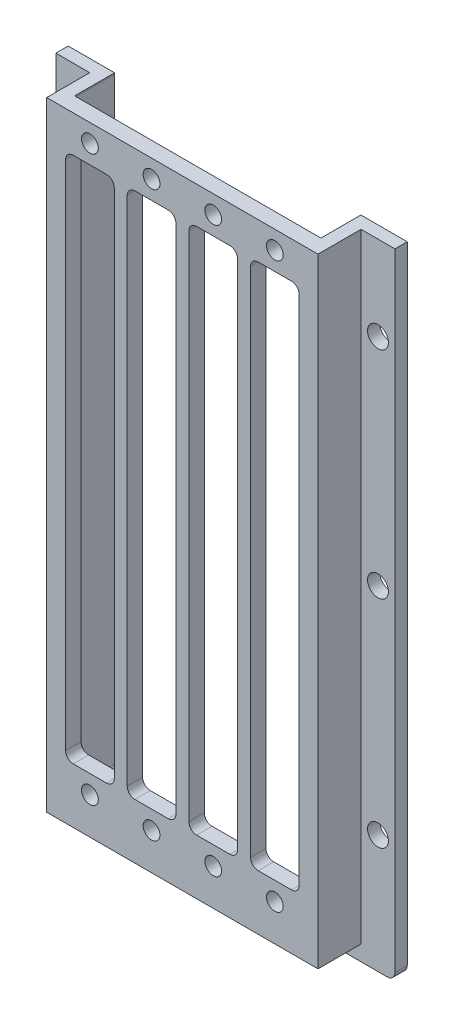
from build123d import *

# Parameters (mm, degrees)
SKETCH1_W                 = 50.8
SKETCH1_H                 = 126.238
BACK_DEPTH                = 3.175
CUT_EXTRUDE3_DEPTH        = 69.11203114
F_4_CLEARANCE_HOLE1_D     = 3.4544
LPATTERN1_OUTLINE_R       = 1.7272
LPATTERN1_DEPTH           = 3.175
SKETCH9_W                 = 55.88
SKETCH9_H                 = 131.318
WALLS_DEPTH               = 11.405821857
SKETCH11_W                = 69.85
SKETCH11_H                = 137.668
SKETCH11_W_2              = 50.8
SKETCH11_H_2              = 126.238
LIP_DEPTH                 = 2.54
F_6_CLEARANCE_OVERSIZED_D = 4.3053
FILLET2_R                 = 1.5875
CUT_EXTRUDE4_DEPTH        = 6.858
CUT_EXTRUDE4_DEPTH_BACK   = 3.81
SKETCH19_W                = 76.814856898
SKETCH19_H                = 21.095936882


# Read off the part's stored shape, not the designer's step: LPattern1
with BuildPart() as part:
    # Sketch1 → back (new body)
    with BuildSketch(Plane.XY):
        Rectangle(SKETCH1_W, SKETCH1_H)
    extrude(amount=BACK_DEPTH)

    # Sketch6 → Cut-Extrude3 (cut, through all)
    with BuildSketch(Plane.XY.offset(3.175)):
        with BuildLine():
            Line((24.07, -52.705), (24.07, 52.705))
            ThreePointArc((24.07, 52.705), (23.605032015, 53.827532015), (22.4825, 54.2925))
            Line((22.4825, 54.2925), (15.6245, 54.2925))
            ThreePointArc((15.6245, 54.2925), (14.501967985, 53.827532015), (14.037, 52.705))
            Line((14.037, 52.705), (14.037, -52.705))
            ThreePointArc((14.037, -52.705), (14.501967985, -53.827532015), (15.6245, -54.2925))
            Line((15.6245, -54.2925), (22.4825, -54.2925))
            ThreePointArc((22.4825, -54.2925), (23.605032015, -53.827532015), (24.07, -52.705))
        make_face()
    extrude(amount=-CUT_EXTRUDE3_DEPTH, mode=Mode.SUBTRACT)

    # #4 Clearance Hole1 (through all)
    with Locations(Plane(origin=(19.0535, 58.1025, 3.175), x_dir=(1, 0, 0), z_dir=(0, 0, 1))):
        with Locations((0, 0), (0, -116.205)):
            Hole(F_4_CLEARANCE_HOLE1_D / 2)

    # LPattern1 outline → LPattern1 (cut)
    with BuildSketch(Plane.XY):
        with BuildLine():
            ThreePointArc((1.337, -52.705), (1.801967985, -53.827532015), (2.9245, -54.2925))
            Line((2.9245, -54.2925), (9.7825, -54.2925))
            ThreePointArc((9.7825, -54.2925), (10.905032015, -53.827532015), (11.37, -52.705))
            Line((11.37, -52.705), (11.37, 52.705))
            ThreePointArc((11.37, 52.705), (10.905032015, 53.827532015), (9.7825, 54.2925))
            Line((9.7825, 54.2925), (2.9245, 54.2925))
            ThreePointArc((2.9245, 54.2925), (1.801967985, 53.827532015), (1.337, 52.705))
            Line((1.337, 52.705), (1.337, -52.705))
        make_face()
        with BuildLine():
            ThreePointArc((-11.363, -52.705), (-10.898032015, -53.827532015), (-9.7755, -54.2925))
            Line((-9.7755, -54.2925), (-2.9175, -54.2925))
            ThreePointArc((-2.9175, -54.2925), (-1.794967985, -53.827532015), (-1.33, -52.705))
            Line((-1.33, -52.705), (-1.33, 52.705))
            ThreePointArc((-1.33, 52.705), (-1.794967985, 53.827532015), (-2.9175, 54.2925))
            Line((-2.9175, 54.2925), (-9.7755, 54.2925))
            ThreePointArc((-9.7755, 54.2925), (-10.898032015, 53.827532015), (-11.363, 52.705))
            Line((-11.363, 52.705), (-11.363, -52.705))
        make_face()
        with BuildLine():
            ThreePointArc((-24.063, -52.705), (-23.598032015, -53.827532015), (-22.4755, -54.2925))
            Line((-22.4755, -54.2925), (-15.6175, -54.2925))
            ThreePointArc((-15.6175, -54.2925), (-14.494967985, -53.827532015), (-14.03, -52.705))
            Line((-14.03, -52.705), (-14.03, 52.705))
            ThreePointArc((-14.03, 52.705), (-14.494967985, 53.827532015), (-15.6175, 54.2925))
            Line((-15.6175, 54.2925), (-22.4755, 54.2925))
            ThreePointArc((-22.4755, 54.2925), (-23.598032015, 53.827532015), (-24.063, 52.705))
            Line((-24.063, 52.705), (-24.063, -52.705))
        make_face()
        with Locations((6.3535, -58.1025)):
            Circle(LPATTERN1_OUTLINE_R)
        with Locations((-6.3465, -58.1025)):
            Circle(LPATTERN1_OUTLINE_R)
        with Locations((-19.0465, -58.1025)):
            Circle(LPATTERN1_OUTLINE_R)
        with Locations((6.3535, 58.1025)):
            Circle(LPATTERN1_OUTLINE_R)
        with Locations((-6.3465, 58.1025)):
            Circle(LPATTERN1_OUTLINE_R)
        with Locations((-19.0465, 58.1025)):
            Circle(LPATTERN1_OUTLINE_R)
    extrude(amount=LPATTERN1_DEPTH, mode=Mode.SUBTRACT)

    # Sketch9 → walls (add)
    with BuildSketch(Plane.XY.offset(3.175)):
        Rectangle(SKETCH9_W, SKETCH9_H)
        with BuildLine():
            Line((25.4, -61.5315), (25.4, 61.5315))
            ThreePointArc((25.4, 61.5315), (24.935032015, 62.654032015), (23.8125, 63.119))
            Line((23.8125, 63.119), (-23.8125, 63.119))
            ThreePointArc((-23.8125, 63.119), (-24.935032015, 62.654032015), (-25.4, 61.5315))
            Line((-25.4, 61.5315), (-25.4, -61.5315))
            ThreePointArc((-25.4, -61.5315), (-24.935032015, -62.654032015), (-23.8125, -63.119))
            Line((-23.8125, -63.119), (23.8125, -63.119))
            ThreePointArc((23.8125, -63.119), (24.935032015, -62.654032015), (25.4, -61.5315))
        make_face(mode=Mode.SUBTRACT)
    extrude(amount=-WALLS_DEPTH)

    # Sketch11 → lip (add)
    with BuildSketch(Plane(origin=(0, 0, -8.230821857), x_dir=(-1, 0, 0), z_dir=(0, 0, -1))):
        Rectangle(SKETCH11_W, SKETCH11_H)
        Rectangle(SKETCH11_W_2, SKETCH11_H_2, mode=Mode.SUBTRACT)
    extrude(amount=-LIP_DEPTH)

    # #6 Clearance OVERSIZED (through all)
    with Locations(Plane(origin=(-31.4325, 44.45, -5.690821857), x_dir=(1, 0, 0), z_dir=(0, 0, 1))):
        with Locations((0, 0), (0, -44.45), (0, -88.9)):
            f_6_clearance_oversized = Hole(F_6_CLEARANCE_OVERSIZED_D / 2)

    # Fillet2
    fillet2_edges = [part.edges().sort_by_distance(p)[0] for p in [
        (34.925, 68.834, -6.960821857),
        (-34.925, 68.834, -6.960821857),
        (-34.925, -68.834, -6.960821857),
        (34.925, -68.834, -6.960821857),
    ]]
    fillet(fillet2_edges, radius=FILLET2_R)

    # Mirror2: #6 Clearance OVERSIZED across plane
    add(f_6_clearance_oversized.mirror(Plane(origin=(0, 0, 0), x_dir=(0, 0, 1), z_dir=(1, 0, 0))), mode=Mode.SUBTRACT)

    # Sketch19 → Cut-Extrude4 (cut, two sides: drawn at the far end of the back side and taken through both)
    with BuildSketch(Plane(origin=(0, 65.659, 0), x_dir=(1, 0, 0), z_dir=(0, 1, 0)).offset(-CUT_EXTRUDE4_DEPTH_BACK)):
        Rectangle(SKETCH19_W, SKETCH19_H)
    extrude(amount=CUT_EXTRUDE4_DEPTH + CUT_EXTRUDE4_DEPTH_BACK, mode=Mode.SUBTRACT)


solid = part.part
